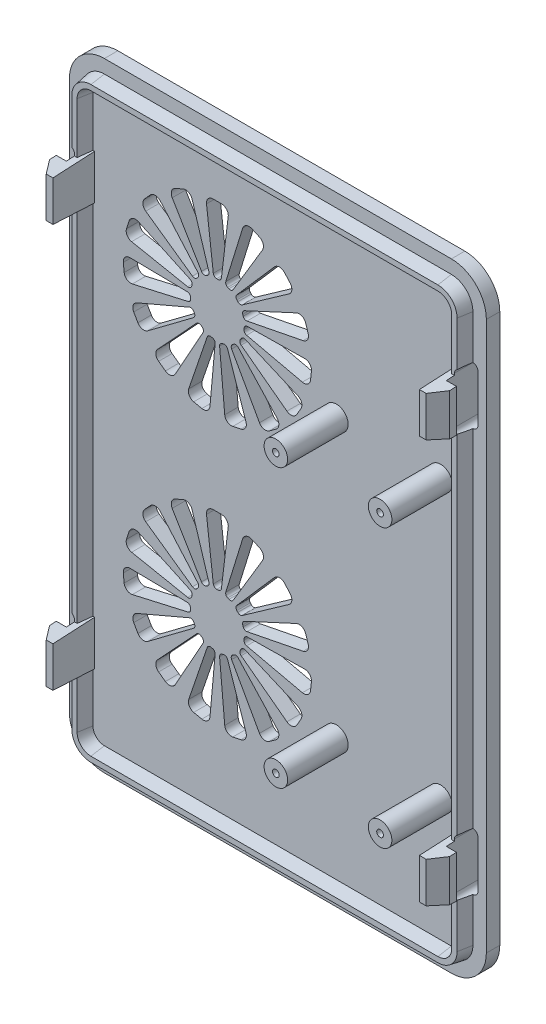
from build123d import *

# Parameters (mm, degrees)
BOSS_EXTRUDE1_DEPTH          = 2
BOSS_EXTRUDE2_DEPTH          = 2
BOSS_EXTRUDE2_DRAFT          = 10
CUT_EXTRUDE1_DEPTH           = 56.614746246
FILLET1_R                    = 1
FILLET2_R                    = 0.5
CIRPATTERN1_COUNT            = 15
FILLET1_OF_CIRPATTERN1_R     = 1
FILLET2_OF_CIRPATTERN1_R     = 0.5
SNAP_START                   = -28.25
SNAP_HOOK1_DEPTH             = 1
SNAP_HOOK1_2_DEPTH           = 1
CUT_EXTRUDE2_DEPTH           = 56.62948859
MIRROR2_START                = -1
MIRROR2_DEPTH                = 6.2
MIRROR2_START_2              = 27.25
MIRROR2_2_DEPTH              = 1
SKETCH7_R                    = 1.75
BOSS_EXTRUDE3_DEPTH          = 9
F_1_0_1_DIAMETER_HOLE1_D     = 1
F_1_0_1_DIAMETER_HOLE1_DEPTH = 8
F_1_0_1_DIAMETER_HOLE1_TIP   = 0.30043031
LPATTERN1_DEPTH              = 2


with BuildPart() as part:
    # Sketch1 → Boss-Extrude1 (new body)
    with BuildSketch(Plane.XY):
        with BuildLine():
            Line((25.8, 46), (-25.8, 46))
            ThreePointArc((-25.8, 46), (-29.476955262, 44.476955262), (-31, 40.8))
            Line((-31, 40.8), (-31, -40.8))
            ThreePointArc((-31, -40.8), (-29.476955262, -44.476955262), (-25.8, -46))
            Line((-25.8, -46), (25.8, -46))
            ThreePointArc((25.8, -46), (29.476955262, -44.476955262), (31, -40.8))
            Line((31, -40.8), (31, 40.8))
            ThreePointArc((31, 40.8), (29.476955262, 44.476955262), (25.8, 46))
        make_face()
    extrude(amount=BOSS_EXTRUDE1_DEPTH)


with BuildPart() as boss_extrude2_tool:
    # Sketch3 → Boss-Extrude2 (with draft: the straight prism first)
    with BuildSketch(Plane.XY.offset(2)):
        with BuildLine():
            Line((25.8, 44), (-25.8, 44))
            ThreePointArc((-25.8, 44), (-28.0627417, 43.0627417), (-29, 40.8))
            Line((-29, 40.8), (-29, -40.8))
            ThreePointArc((-29, -40.8), (-28.0627417, -43.0627417), (-25.8, -44))
            Line((-25.8, -44), (25.8, -44))
            ThreePointArc((25.8, -44), (28.0627417, -43.0627417), (29, -40.8))
            Line((29, -40.8), (29, 40.8))
            ThreePointArc((29, 40.8), (28.0627417, 43.0627417), (25.8, 44))
        make_face()
        with BuildLine():
            Line((27.5, -40.8), (27.5, 40.8))
            ThreePointArc((27.5, 40.8), (27.002081528, 42.002081528), (25.8, 42.5))
            Line((25.8, 42.5), (-25.8, 42.5))
            ThreePointArc((-25.8, 42.5), (-27.002081528, 42.002081528), (-27.5, 40.8))
            Line((-27.5, 40.8), (-27.5, -40.8))
            ThreePointArc((-27.5, -40.8), (-27.002081528, -42.002081528), (-25.8, -42.5))
            Line((-25.8, -42.5), (25.8, -42.5))
            ThreePointArc((25.8, -42.5), (27.002081528, -42.002081528), (27.5, -40.8))
        make_face(mode=Mode.SUBTRACT)
    extrude(amount=BOSS_EXTRUDE2_DEPTH)
    # Boss-Extrude2: the draft: its side faces are tilted about the plane it starts from
    boss_extrude2_sides = [boss_extrude2_tool.faces().sort_by_distance(p)[0] for p in [
        (28.0627417, 43.0627417, 3),
        (0, 44, 3),
        (-28.0627417, 43.0627417, 3),
        (-29, 0, 3),
        (-28.0627417, -43.0627417, 3),
        (0, -44, 3),
        (28.0627417, -43.0627417, 3),
        (29, 0, 3),
        (27.002081528, -42.002081528, 3),
        (0, -42.5, 3),
        (-27.002081528, -42.002081528, 3),
        (-27.5, 0, 3),
        (-27.002081528, 42.002081528, 3),
        (0, 42.5, 3),
        (27.002081528, 42.002081528, 3),
        (27.5, 0, 3),
    ]]
    draft(boss_extrude2_sides, Plane.XY.offset(2), BOSS_EXTRUDE2_DRAFT)


with BuildPart() as part_1:
    add(part.part)

    # Boss-Extrude2: add boss_extrude2_tool
    add(boss_extrude2_tool.part)

    # Sketch4 → Cut-Extrude1 (cut, through all)
    with BuildSketch(Plane(origin=(0, 0, 0), x_dir=(-1, 0, 0), z_dir=(0, 0, -1))):
        Polygon((8.45, -14), (7.25, -4), (10.75, -4), (9.55, -14), align=None)
    cut_extrude1 = extrude(amount=-CUT_EXTRUDE1_DEPTH, mode=Mode.SUBTRACT)

    # Fillet1
    fillet1_edges = [part_1.edges().sort_by_distance(p)[0] for p in [
        (-7.25, -4, 1),
        (-10.75, -4, 1),
    ]]
    fillet(fillet1_edges, radius=FILLET1_R)

    # Fillet2
    fillet2_edges = [part_1.edges().sort_by_distance(p)[0] for p in [
        (-9.55, -14, 1),
        (-8.45, -14, 1),
    ]]
    fillet(fillet2_edges, radius=FILLET2_R)

    # CirPattern1: Cut-Extrude1 ×15 about axis
    cirpattern1_axis = Axis((-9, -18, 0), (0, 0, 1))
    for i in range(1, CIRPATTERN1_COUNT):
        add(cut_extrude1.rotate(cirpattern1_axis, i * 360 / CIRPATTERN1_COUNT), mode=Mode.SUBTRACT)

    # Fillet1 of CirPattern1
    fillet1_of_cirpattern1_edges = [part_1.edges().sort_by_distance(p)[0] for p in [
        (-13.095608452, -4.498574468, 1),
        (-16.293017554, -5.922152718, 1),
        (-18.233048996, -7.331668066, 1),
        (-20.575006118, -9.932674956, 1),
        (-21.774011488, -12.009413175, 1),
        (-22.855570968, -15.338110982, 1),
        (-23.106231346, -17.722985169, 1),
        (-22.740381724, -21.203811803, 1),
        (-21.999355653, -23.484455543, 1),
        (-20.249355653, -26.515544457, 1),
        (-18.644773272, -28.29761373, 1),
        (-15.813213792, -30.354862113, 1),
        (-13.622521973, -31.330220951, 1),
        (-10.19900537, -32.057911869, 1),
        (-7.80099463, -32.057911869, 1),
        (-4.377478027, -31.330220951, 1),
        (-2.186786208, -30.354862113, 1),
        (0.644773272, -28.29761373, 1),
        (2.249355653, -26.515544457, 1),
        (3.999355653, -23.484455543, 1),
        (4.740381724, -21.203811803, 1),
        (5.106231346, -17.722985169, 1),
        (4.855570968, -15.338110982, 1),
        (3.774011488, -12.009413175, 1),
        (2.575006118, -9.932674956, 1),
        (0.233048996, -7.331668066, 1),
        (-1.706982446, -5.922152718, 1),
        (-4.904391548, -4.498574468, 1),
    ]]
    fillet(fillet1_of_cirpattern1_edges, radius=FILLET1_OF_CIRPATTERN1_R)

    # Fillet2 of CirPattern1
    fillet2_of_cirpattern1_edges = [part_1.edges().sort_by_distance(p)[0] for p in [
        (-11.129396574, -14.569523323, 1),
        (-10.124496571, -14.122113016, 1),
        (-12.340601135, -15.732207229, 1),
        (-11.604557468, -14.914747921, 1),
        (-12.974185412, -17.287013106, 1),
        (-12.634266718, -16.240850939, 1),
        (-12.920596927, -18.965100896, 1),
        (-13.035578236, -17.871126811, 1),
        (-12.189101615, -20.476313972, 1),
        (-12.739101615, -19.523686028, 1),
        (-10.906181662, -21.559349866, 1),
        (-11.796100356, -20.912786089, 1),
        (-9.293665583, -22.026941833, 1),
        (-10.369627944, -21.798238973, 1),
        (-7.630372056, -21.798238973, 1),
        (-8.706334417, -22.026941833, 1),
        (-6.203899644, -20.912786089, 1),
        (-7.093818338, -21.559349866, 1),
        (-5.260898385, -19.523686028, 1),
        (-5.810898385, -20.476313972, 1),
        (-4.964421764, -17.871126811, 1),
        (-5.079403073, -18.965100896, 1),
        (-5.365733282, -16.240850939, 1),
        (-5.025814588, -17.287013106, 1),
        (-6.395442532, -14.914747921, 1),
        (-5.659398865, -15.732207229, 1),
        (-7.875503429, -14.122113016, 1),
        (-6.870603426, -14.569523323, 1),
    ]]
    fillet(fillet2_of_cirpattern1_edges, radius=FILLET2_OF_CIRPATTERN1_R)



with BuildPart() as body_2:
    # Snap Hook1: read off the stored shape, not the designer's step
    # Snap Hook1 outline → Snap Hook1 (new body)
    with BuildSketch(Plane.YZ.offset(SNAP_START)):
        Polygon((33.157223338, 5.2), (33, 8.2), (27, 8.2), (26.842776662, 5.2), align=None)
    snap_hook1 = extrude(amount=SNAP_HOOK1_DEPTH)


with BuildPart() as part_2:
    add(part_1.part)

    add(body_2.part)  # Snap Hook1 2 merges body 2
    # Snap Hook1 2 outline → Snap Hook1 2 (add)
    with BuildSketch(Plane.YZ.offset(SNAP_START)):
        Polygon((33.157223338, 5.2), (26.842776662, 5.2), (26.675071768, 2), (33.324928232, 2), align=None)
    snap_hook1_2 = extrude(amount=SNAP_HOOK1_2_DEPTH)

    # Snap Hook1 3: loft between two sections, ruled curve by curve
    snap_hook1_3_from = [
        Edge.make_line((-29.75, 33.104815559, 6.2), (-29.75, 26.895184441, 6.2)),
        Edge.make_line((-29.75, 26.842776662, 5.2), (-29.75, 33.157223338, 5.2)),
        Edge.make_line((-29.75, 33.157223338, 5.2), (-29.75, 33.104815559, 6.2)),
        Edge.make_line((-29.75, 26.842776662, 5.2), (-29.75, 26.895184441, 6.2)),
    ]
    snap_hook1_3_to = [
        Edge.make_line((-28.25, 33, 8.2), (-28.25, 27, 8.2)),
        Edge.make_line((-28.25, 26.842776662, 5.2), (-28.25, 33.157223338, 5.2)),
        Edge.make_line((-28.25, 33.157223338, 5.2), (-28.25, 33, 8.2)),
        Edge.make_line((-28.25, 26.842776662, 5.2), (-28.25, 27, 8.2)),
    ]
    snap_hook1_3 = Solid(Shell([*[Face.make_surface_from_curves(snap_hook1_3_from[k], snap_hook1_3_to[k]) for k in range(4)], Face(Wire(snap_hook1_3_from)), Face(Wire(snap_hook1_3_to))]))
    add(snap_hook1_3)

    # Sketch5 → Cut-Extrude2 (cut, through all)
    with BuildSketch(Plane.XY.offset(4)):
        with BuildLine():
            Line((-28.25, 33.5), (-28.25, 26.5))
            ThreePointArc((-28.25, 26.5), (-29, 25.75), (-29.75, 26.5))
            Line((-29.75, 26.5), (-29.75, 33.5))
            ThreePointArc((-29.75, 33.5), (-29, 34.25), (-28.25, 33.5))
        make_face()
    cut_extrude2 = extrude(amount=-CUT_EXTRUDE2_DEPTH, mode=Mode.SUBTRACT)

    # Mirror1: Snap Hook1, Snap Hook1 2, Snap Hook1 3, Cut-Extrude2 across plane
    add(snap_hook1.mirror(Plane.ZX))
    add(snap_hook1_2.mirror(Plane.ZX))
    add(snap_hook1_3.mirror(Plane.ZX))
    add(cut_extrude2.mirror(Plane.ZX), mode=Mode.SUBTRACT)

    # Mirror2: read off the stored shape, not the designer's step
    # Mirror2 outline → Mirror2 (cut)
    with BuildSketch(Plane.XY.offset(MIRROR2_START)):
        with BuildLine():
            Line((29.75, 26.5), (29.75, 33.5))
            ThreePointArc((29.75, 33.5), (29, 34.25), (28.25, 33.5))
            Line((28.25, 33.5), (28.25, 26.5))
            ThreePointArc((28.25, 26.5), (29, 25.75), (29.75, 26.5))
        make_face()
        with BuildLine():
            Line((29.75, -33.5), (29.75, -26.5))
            ThreePointArc((29.75, -26.5), (29, -25.75), (28.25, -26.5))
            Line((28.25, -26.5), (28.25, -33.5))
            ThreePointArc((28.25, -33.5), (29, -34.25), (29.75, -33.5))
        make_face()
    extrude(amount=MIRROR2_DEPTH, mode=Mode.SUBTRACT)

    # Mirror2 2 outline → Mirror2 2 (add)
    with BuildSketch(Plane.YZ.offset(MIRROR2_START_2)):
        Polygon((33, 8.2), (27, 8.2), (26.675071768, 2), (33.324928232, 2), align=None)
        Polygon((-33.324928232, 2), (-26.675071768, 2), (-27, 8.2), (-33, 8.2), align=None)
    extrude(amount=MIRROR2_2_DEPTH)

    # Mirror2 3: loft between two sections, ruled curve by curve
    mirror2_3_from = [
        Edge.make_line((29.75, 26.842776662, 5.2), (29.75, 33.157223338, 5.2)),
        Edge.make_line((29.75, 33.104815559, 6.2), (29.75, 26.895184441, 6.2)),
        Edge.make_line((29.75, 33.104815559, 6.2), (29.75, 33.157223338, 5.2)),
        Edge.make_line((29.75, 26.895184441, 6.2), (29.75, 26.842776662, 5.2)),
    ]
    mirror2_3_to = [
        Edge.make_line((28.25, 26.842776662, 5.2), (28.25, 33.157223338, 5.2)),
        Edge.make_line((28.25, 33, 8.2), (28.25, 27, 8.2)),
        Edge.make_line((28.25, 33, 8.2), (28.25, 33.157223338, 5.2)),
        Edge.make_line((28.25, 27, 8.2), (28.25, 26.842776662, 5.2)),
    ]
    mirror2_3 = Solid(Shell([*[Face.make_surface_from_curves(mirror2_3_from[k], mirror2_3_to[k]) for k in range(4)], Face(Wire(mirror2_3_from)), Face(Wire(mirror2_3_to))]))
    add(mirror2_3)

    # Mirror2 4: loft between two sections, ruled curve by curve
    mirror2_4_from = [
        Edge.make_line((29.75, -26.842776662, 5.2), (29.75, -33.157223338, 5.2)),
        Edge.make_line((29.75, -33.104815559, 6.2), (29.75, -26.895184441, 6.2)),
        Edge.make_line((29.75, -33.104815559, 6.2), (29.75, -33.157223338, 5.2)),
        Edge.make_line((29.75, -26.895184441, 6.2), (29.75, -26.842776662, 5.2)),
    ]
    mirror2_4_to = [
        Edge.make_line((28.25, -26.842776662, 5.2), (28.25, -33.157223338, 5.2)),
        Edge.make_line((28.25, -33, 8.2), (28.25, -27, 8.2)),
        Edge.make_line((28.25, -33, 8.2), (28.25, -33.157223338, 5.2)),
        Edge.make_line((28.25, -27, 8.2), (28.25, -26.842776662, 5.2)),
    ]
    mirror2_4 = Solid(Shell([*[Face.make_surface_from_curves(mirror2_4_from[k], mirror2_4_to[k]) for k in range(4)], Face(Wire(mirror2_4_from)), Face(Wire(mirror2_4_to))]))
    add(mirror2_4)

    # Sketch7 → Boss-Extrude3 (add)
    with BuildSketch(Plane.XY.offset(2)):
        with Locations((8.7, 17)):
            Circle(SKETCH7_R)
        with Locations((24.2, 17)):
            Circle(SKETCH7_R)
        with Locations((24.2, -24.3)):
            Circle(SKETCH7_R)
        with Locations((8.7, -24.3)):
            Circle(SKETCH7_R)
    extrude(amount=BOSS_EXTRUDE3_DEPTH)

    # Ø1.0 (1) Diameter Hole1
    with Locations(Plane.XY.offset(11)):
        with Locations((8.7, 17), (24.2, 17), (8.7, -24.3), (24.2, -24.3)):
            Hole(F_1_0_1_DIAMETER_HOLE1_D / 2, depth=F_1_0_1_DIAMETER_HOLE1_DEPTH)
            with Locations((0, 0, -(F_1_0_1_DIAMETER_HOLE1_DEPTH + F_1_0_1_DIAMETER_HOLE1_TIP / 2))):  # 118° drill point
                Cone(0, F_1_0_1_DIAMETER_HOLE1_D / 2, F_1_0_1_DIAMETER_HOLE1_TIP, mode=Mode.SUBTRACT)

    # LPattern1: read off the stored shape, not the designer's step
    # LPattern1 outline → LPattern1 (cut)
    with BuildSketch(Plane.XY):
        with BuildLine():
            ThreePointArc((-9.602851287, 26.44042739), (-9.438236387, 26.125977069), (-9.106412868, 26))
            Line((-9.106412868, 26), (-8.893587132, 26))
            ThreePointArc((-8.893587132, 26), (-8.561763613, 26.125977069), (-8.397148713, 26.44042739))
            Line((-8.397148713, 26.44042739), (-7.384297426, 34.880854779))
            ThreePointArc((-7.384297426, 34.880854779), (-7.629128404, 35.663647037), (-8.377174265, 36))
            Line((-8.377174265, 36), (-9.622825735, 36))
            ThreePointArc((-9.622825735, 36), (-10.370871596, 35.663647037), (-10.615702574, 34.880854779))
            Line((-10.615702574, 34.880854779), (-9.602851287, 26.44042739))
        make_face()
        with BuildLine():
            ThreePointArc((-13.409388697, 22.798821881), (-13.059459869, 22.858209462), (-12.83710945, 23.134863326))
            Line((-12.83710945, 23.134863326), (-12.771342681, 23.337272629))
            ThreePointArc((-12.771342681, 23.337272629), (-12.788614887, 23.691784603), (-13.036806111, 23.94551317))
            Line((-13.036806111, 23.94551317), (-20.75114132, 27.51702749))
            ThreePointArc((-20.75114132, 27.51702749), (-21.57127793, 27.526075504), (-22.122327491, 26.918580395))
            Line((-22.122327491, 26.918580395), (-22.507254965, 25.733895447))
            ThreePointArc((-22.507254965, 25.733895447), (-22.418523171, 24.918522775), (-21.749700426, 24.443778568))
            Line((-21.749700426, 24.443778568), (-13.409388697, 22.798821881))
        make_face()
        with BuildLine():
            ThreePointArc((-13.353087145, 20.936300144), (-13.057566359, 21.132882276), (-12.966964408, 21.47605622))
            Line((-12.966964408, 21.47605622), (-12.989210755, 21.687716074))
            ThreePointArc((-12.989210755, 21.687716074), (-13.149182711, 22.004553639), (-13.479117382, 22.135397753))
            Line((-13.479117382, 22.135397753), (-21.979179016, 22.26043563))
            ThreePointArc((-21.979179016, 22.26043563), (-22.73209125, 21.935121791), (-22.988409552, 21.156015345))
            Line((-22.988409552, 21.156015345), (-22.858203518, 19.917187684))
            ThreePointArc((-22.858203518, 19.917187684), (-22.445501048, 19.208398154), (-21.641405202, 19.046732459))
            Line((-21.641405202, 19.046732459), (-13.353087145, 20.936300144))
        make_face()
        with BuildLine():
            ThreePointArc((-11.122300797, 18.053271684), (-11.070647789, 18.404425548), (-11.265051191, 18.701384108))
            Line((-11.265051191, 18.701384108), (-11.437230827, 18.826479937))
            ThreePointArc((-11.437230827, 18.826479937), (-11.779729157, 18.919603317), (-12.09773467, 18.761965875))
            Line((-12.09773467, 18.761965875), (-17.878307316, 12.528855726))
            ThreePointArc((-17.878307316, 12.528855726), (-18.140348639, 11.751655449), (-17.732870136, 11.039849861))
            Line((-17.732870136, 11.039849861), (-16.725116928, 10.307674297))
            ThreePointArc((-16.725116928, 10.307674297), (-15.922231802, 10.140099235), (-15.264045636, 10.629483437))
            Line((-15.264045636, 10.629483437), (-11.122300797, 18.053271684))
        make_face()
        with BuildLine():
            ThreePointArc((-12.54409728, 19.257701776), (-12.354082765, 19.557487622), (-12.410895181, 19.907843753))
            Line((-12.410895181, 19.907843753), (-12.517308049, 20.092156247))
            ThreePointArc((-12.517308049, 20.092156247), (-12.792319151, 20.316535308), (-13.146948567, 20.301870834))
            Line((-13.146948567, 20.301870834), (-20.962998748, 16.958812084))
            ThreePointArc((-20.962998748, 16.958812084), (-21.51850124, 16.355386109), (-21.435768521, 15.539382909))
            Line((-21.435768521, 15.539382909), (-20.812942785, 14.460617091))
            ThreePointArc((-20.812942785, 14.460617091), (-20.147629644, 13.980966854), (-19.347296175, 14.160333137))
            Line((-19.347296175, 14.160333137), (-12.54409728, 19.257701776))
        make_face()
        with BuildLine():
            ThreePointArc((-11.356816585, 25.811330563), (-11.078534922, 25.591020814), (-10.724159564, 25.610899818))
            Line((-10.724159564, 25.610899818), (-10.529733581, 25.697463843))
            ThreePointArc((-10.529733581, 25.697463843), (-10.277837203, 25.947514406), (-10.255352476, 26.30173398))
            Line((-10.255352476, 26.30173398), (-12.763097886, 34.424411815))
            ThreePointArc((-12.763097886, 34.424411815), (-13.305152408, 35.039946397), (-14.125333382, 35.042962456))
            Line((-14.125333382, 35.042962456), (-15.263292624, 34.536310358))
            ThreePointArc((-15.263292624, 34.536310358), (-15.809859448, 33.924778974), (-15.71513338, 33.110080933))
            Line((-15.71513338, 33.110080933), (-11.356816585, 25.811330563))
        make_face()
        with BuildLine():
            ThreePointArc((-12.703266885, 24.523220057), (-12.359435888, 24.435144436), (-12.043783408, 24.597442254))
            Line((-12.043783408, 24.597442254), (-11.901375195, 24.755602597))
            ThreePointArc((-11.901375195, 24.755602597), (-11.772961131, 25.086490641), (-11.896494391, 25.419231686))
            Line((-11.896494391, 25.419231686), (-17.491224534, 31.819675176))
            ThreePointArc((-17.491224534, 31.819675176), (-18.23677645, 32.16152056), (-18.987275795, 31.830678211))
            Line((-18.987275795, 31.830678211), (-19.820779318, 30.904978767))
            ThreePointArc((-19.820779318, 30.904978767), (-20.071360735, 30.124008294), (-19.65345662, 29.418273162))
            Line((-19.65345662, 29.418273162), (-12.703266885, 24.523220057))
        make_face()
        with BuildLine():
            ThreePointArc((-4.520882618, 22.135397753), (-4.850817289, 22.004553639), (-5.010789245, 21.687716074))
            Line((-5.010789245, 21.687716074), (-5.033035592, 21.47605622))
            ThreePointArc((-5.033035592, 21.47605622), (-4.942433641, 21.132882276), (-4.646912855, 20.936300144))
            Line((-4.646912855, 20.936300144), (3.641405202, 19.046732459))
            ThreePointArc((3.641405202, 19.046732459), (4.445501048, 19.208398154), (4.858203518, 19.917187684))
            Line((4.858203518, 19.917187684), (4.988409552, 21.156015345))
            ThreePointArc((4.988409552, 21.156015345), (4.73209125, 21.935121791), (3.979179016, 22.26043563))
            Line((3.979179016, 22.26043563), (-4.520882618, 22.135397753))
        make_face()
        with BuildLine():
            ThreePointArc((-4.963193889, 23.94551317), (-5.211385113, 23.691784603), (-5.228657319, 23.337272629))
            Line((-5.228657319, 23.337272629), (-5.16289055, 23.134863326))
            ThreePointArc((-5.16289055, 23.134863326), (-4.940540131, 22.858209462), (-4.590611303, 22.798821881))
            Line((-4.590611303, 22.798821881), (3.749700426, 24.443778568))
            ThreePointArc((3.749700426, 24.443778568), (4.418523171, 24.918522775), (4.507254965, 25.733895447))
            Line((4.507254965, 25.733895447), (4.122327491, 26.918580395))
            ThreePointArc((4.122327491, 26.918580395), (3.57127793, 27.526075504), (2.75114132, 27.51702749))
            Line((2.75114132, 27.51702749), (-4.963193889, 23.94551317))
        make_face()
        with BuildLine():
            ThreePointArc((-7.744647524, 26.30173398), (-7.722162797, 25.947514406), (-7.470266419, 25.697463843))
            Line((-7.470266419, 25.697463843), (-7.275840436, 25.610899818))
            ThreePointArc((-7.275840436, 25.610899818), (-6.921465078, 25.591020814), (-6.643183415, 25.811330563))
            Line((-6.643183415, 25.811330563), (-2.28486662, 33.110080933))
            ThreePointArc((-2.28486662, 33.110080933), (-2.190140552, 33.924778974), (-2.736707376, 34.536310358))
            Line((-2.736707376, 34.536310358), (-3.874666618, 35.042962456))
            ThreePointArc((-3.874666618, 35.042962456), (-4.694847592, 35.039946397), (-5.236902114, 34.424411815))
            Line((-5.236902114, 34.424411815), (-7.744647524, 26.30173398))
        make_face()
        with BuildLine():
            ThreePointArc((-6.103505609, 25.419231686), (-6.227038869, 25.086490641), (-6.098624805, 24.755602597))
            Line((-6.098624805, 24.755602597), (-5.956216592, 24.597442254))
            ThreePointArc((-5.956216592, 24.597442254), (-5.640564112, 24.435144436), (-5.296733115, 24.523220057))
            Line((-5.296733115, 24.523220057), (1.65345662, 29.418273162))
            ThreePointArc((1.65345662, 29.418273162), (2.071360735, 30.124008294), (1.820779318, 30.904978767))
            Line((1.820779318, 30.904978767), (0.987275795, 31.830678211))
            ThreePointArc((0.987275795, 31.830678211), (0.23677645, 32.16152056), (-0.508775466, 31.819675176))
            Line((-0.508775466, 31.819675176), (-6.103505609, 25.419231686))
        make_face()
        with BuildLine():
            ThreePointArc((-9.333539227, 17.531266772), (-9.429178999, 17.873070961), (-9.727559272, 18.065285118))
            Line((-9.727559272, 18.065285118), (-9.935734254, 18.109534076))
            ThreePointArc((-9.935734254, 18.109534076), (-10.286498738, 18.055299897), (-10.512894306, 17.781946433))
            Line((-10.512894306, 17.781946433), (-13.258475892, 9.736546256))
            ThreePointArc((-13.258475892, 9.736546256), (-13.181746721, 8.919956665), (-12.51997917, 8.435426341))
            Line((-12.51997917, 8.435426341), (-11.301548173, 8.176440838))
            ThreePointArc((-11.301548173, 8.176440838), (-10.499917196, 8.349916202), (-10.097684701, 9.064699348))
            Line((-10.097684701, 9.064699348), (-9.333539227, 17.531266772))
        make_face()
        with BuildLine():
            ThreePointArc((-7.487105694, 17.781946433), (-7.713501262, 18.055299897), (-8.064265746, 18.109534076))
            Line((-8.064265746, 18.109534076), (-8.272440728, 18.065285118))
            ThreePointArc((-8.272440728, 18.065285118), (-8.570821001, 17.873070961), (-8.666460773, 17.531266772))
            Line((-8.666460773, 17.531266772), (-7.902315299, 9.064699348))
            ThreePointArc((-7.902315299, 9.064699348), (-7.500082804, 8.349916202), (-6.698451827, 8.176440838))
            Line((-6.698451827, 8.176440838), (-5.48002083, 8.435426341))
            ThreePointArc((-5.48002083, 8.435426341), (-4.818253279, 8.919956665), (-4.741524108, 9.736546256))
            Line((-4.741524108, 9.736546256), (-7.487105694, 17.781946433))
        make_face()
        with BuildLine():
            ThreePointArc((-4.853051433, 20.301870834), (-5.207680849, 20.316535308), (-5.482691951, 20.092156247))
            Line((-5.482691951, 20.092156247), (-5.589104819, 19.907843753))
            ThreePointArc((-5.589104819, 19.907843753), (-5.645917235, 19.557487622), (-5.45590272, 19.257701776))
            Line((-5.45590272, 19.257701776), (1.347296175, 14.160333137))
            ThreePointArc((1.347296175, 14.160333137), (2.147629644, 13.980966854), (2.812942785, 14.460617091))
            Line((2.812942785, 14.460617091), (3.435768521, 15.539382909))
            ThreePointArc((3.435768521, 15.539382909), (3.51850124, 16.355386109), (2.962998748, 16.958812084))
            Line((2.962998748, 16.958812084), (-4.853051433, 20.301870834))
        make_face()
        with BuildLine():
            ThreePointArc((-5.90226533, 18.761965875), (-6.220270843, 18.919603317), (-6.562769173, 18.826479937))
            Line((-6.562769173, 18.826479937), (-6.734948809, 18.701384108))
            ThreePointArc((-6.734948809, 18.701384108), (-6.929352211, 18.404425548), (-6.877699203, 18.053271684))
            Line((-6.877699203, 18.053271684), (-2.735954364, 10.629483437))
            ThreePointArc((-2.735954364, 10.629483437), (-2.077768198, 10.140099235), (-1.274883072, 10.307674297))
            Line((-1.274883072, 10.307674297), (-0.267129864, 11.039849861))
            ThreePointArc((-0.267129864, 11.039849861), (0.140348639, 11.751655449), (-0.121692684, 12.528855726))
            Line((-0.121692684, 12.528855726), (-5.90226533, 18.761965875))
        make_face()
    extrude(amount=LPATTERN1_DEPTH, mode=Mode.SUBTRACT)


solid = part_2.part
